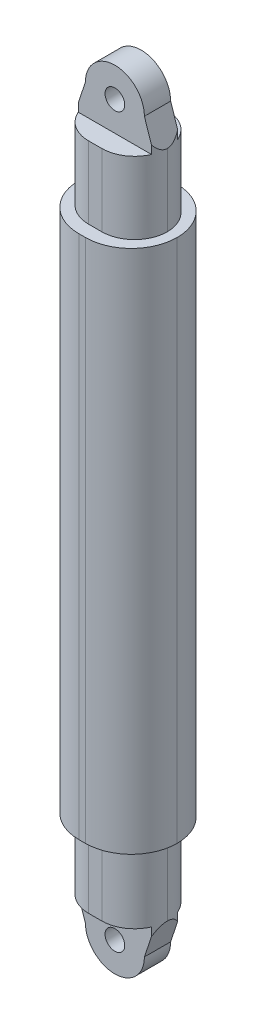
from build123d import *

# Parameters (mm, degrees)
SKETCH2_W                = 12
SKETCH2_H                = 120
BOSS_EXTRUDE1_DEPTH      = 10
FILLET1_R                = 5
CUT_EXTRUDE1_DEPTH       = 3
CUT_EXTRUDE2_START       = 7
SKETCH3_2_W              = 12
SKETCH3_2_H              = 9
CUT_EXTRUDE2_DEPTH       = 3
CUT_EXTRUDE4_START       = -4
CUT_EXTRUDE4_DEPTH       = 66.12282716
SKETCH7_R                = 1.5
CUT_EXTRUDE5_DEPTH       = 61.704200843
BOSS_EXTRUDE2_DEPTH      = 7
BOSS_EXTRUDE2_DEPTH_BACK = 7
SKETCH9_W                = 15
SKETCH9_H                = 80
FILLET3_R                = 7


with BuildPart() as part:
    # Sketch2 → Boss-Extrude1 (new body)
    with BuildSketch(Plane.XY):
        Rectangle(SKETCH2_W, SKETCH2_H)
    extrude(amount=BOSS_EXTRUDE1_DEPTH)

    # Fillet1
    fillet1_edges = [part.edges().sort_by_distance(p)[0] for p in [
        (-6, 0, 0),
        (6, 0, 0),
        (6, 0, 10),
        (-6, 0, 10),
    ]]
    fillet(fillet1_edges, radius=FILLET1_R - 0.0001)  # a hair under: the kernel refuses the full size

    # Sketch3 → Cut-Extrude1 (cut)
    with BuildSketch(Plane.XY):
        with BuildLine():
            Line((-6, -51), (-4.5, -55.5))
            ThreePointArc((-4.5, -55.5), (0, -60), (4.5, -55.5))
            Line((4.5, -55.5), (6, -51))
            Line((6, -51), (-6, -51))
        make_face()
        with BuildLine():
            Line((0, -60), (6, -60))
            Line((6, -60), (6, -51))
            Line((6, -51), (4.5, -55.5))
            ThreePointArc((4.5, -55.5), (3.181980515, -58.681980515), (0, -60))
        make_face()
        with BuildLine():
            Line((-6, -60), (0, -60))
            ThreePointArc((0, -60), (-3.181980515, -58.681980515), (-4.5, -55.5))
            Line((-4.5, -55.5), (-6, -51))
            Line((-6, -51), (-6, -60))
        make_face()
    cut_extrude1 = extrude(amount=CUT_EXTRUDE1_DEPTH, mode=Mode.SUBTRACT)

    # Sketch3<2> → Cut-Extrude2 (cut)
    with BuildSketch(Plane.XY.offset(CUT_EXTRUDE2_START)):
        with Locations((0, -55.5)):
            Rectangle(SKETCH3_2_W, SKETCH3_2_H)
    cut_extrude2 = extrude(amount=CUT_EXTRUDE2_DEPTH, mode=Mode.SUBTRACT)

    # Mirror1: Cut-Extrude1, Cut-Extrude2 across plane
    add(cut_extrude1.mirror(Plane.ZX), mode=Mode.SUBTRACT)
    add(cut_extrude2.mirror(Plane.ZX), mode=Mode.SUBTRACT)

    # Sketch3<4> → Cut-Extrude4 (cut)
    with BuildSketch(Plane.XY.offset(CUT_EXTRUDE4_START)):
        with BuildLine():
            Line((0, -60), (6, -60))
            Line((6, -60), (6, -51))
            Line((6, -51), (4.5, -55.5))
            ThreePointArc((4.5, -55.5), (3.181980515, -58.681980515), (0, -60))
        make_face()
        with BuildLine():
            Line((-6, -60), (0, -60))
            ThreePointArc((0, -60), (-3.181980515, -58.681980515), (-4.5, -55.5))
            Line((-4.5, -55.5), (-6, -51))
            Line((-6, -51), (-6, -60))
        make_face()
    cut_extrude4 = extrude(amount=CUT_EXTRUDE4_DEPTH, mode=Mode.SUBTRACT)

    # Sketch7 → Cut-Extrude5 (cut, through all)
    with BuildSketch(Plane(origin=(0, 0, 3), x_dir=(-1, 0, 0), z_dir=(0, 0, -1))):
        with Locations((0, -55.5)):
            Circle(SKETCH7_R)
    cut_extrude5 = extrude(amount=-CUT_EXTRUDE5_DEPTH, mode=Mode.SUBTRACT)

    # Mirror3: Cut-Extrude5 across plane
    add(cut_extrude5.mirror(Plane.ZX), mode=Mode.SUBTRACT)

    # Mirror4: Cut-Extrude4 across plane
    add(cut_extrude4.mirror(Plane.ZX), mode=Mode.SUBTRACT)

    # Sketch9 → Boss-Extrude2 (add, two sides: drawn at the far end of the back side and taken through both)
    with BuildSketch(Plane.XY.offset(5).offset(-BOSS_EXTRUDE2_DEPTH_BACK)):
        Rectangle(SKETCH9_W, SKETCH9_H)
    extrude(amount=BOSS_EXTRUDE2_DEPTH + BOSS_EXTRUDE2_DEPTH_BACK)

    # Fillet3
    fillet3_edges = [part.edges().sort_by_distance(p)[0] for p in [
        (-7.5, 0, 12),
        (7.5, 0, 12),
        (7.5, 0, -2),
        (-7.5, 0, -2),
    ]]
    fillet(fillet3_edges, radius=FILLET3_R - 0.0001)  # a hair under: the kernel refuses the full size


solid = part.part
